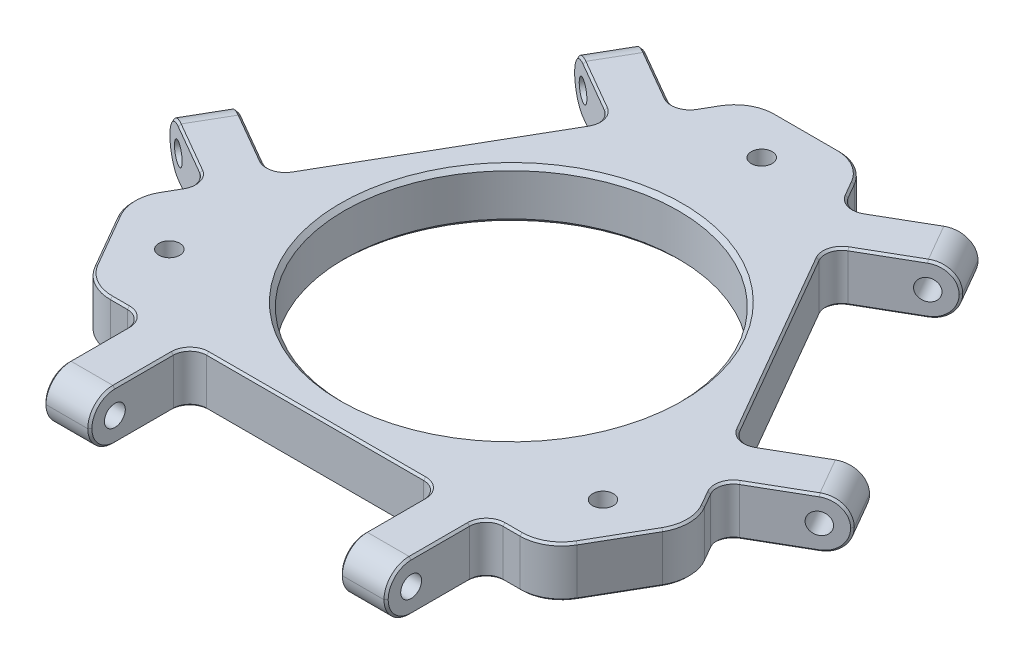
from build123d import *

# Parameters (mm, degrees)
BOSS_EXTRUDE1_DEPTH       = 6
SKETCH2_W                 = 30
SKETCH2_H                 = 12
CUT_EXTRUDE1_DEPTH        = 55.568763959
M3X0_5_TAPPED_HOLE1_D     = 2.5
M3X0_5_TAPPED_HOLE1_DEPTH = 10.697518448
CIRPATTERN1_COUNT         = 3
CIRPATTERN1_COPY_1_D      = 2.5
CIRPATTERN1_COPY_1_DEPTH  = 10.697518448
CIRPATTERN1_COPY_2_D      = 2.5
CIRPATTERN1_COPY_2_DEPTH  = 10.697518448
FILLET1_R                 = 3
M3X0_5_TAPPED_HOLE2_D     = 2.5
SKETCH14_R                = 20
CUT_EXTRUDE2_DEPTH        = 55.568763959
FILLET2_R                 = 2
FILLET3_R                 = 5
CHAMFER1_SIZE             = 0.5
CHAMFER2_SIZE             = 0.25


with BuildPart() as part:
    # Sketch1 → Boss-Extrude1 (new body)
    with BuildSketch(Plane(origin=(0, 0, 0), x_dir=(1, 0, 0), z_dir=(0, 1, 0))):
        Polygon((-20.5, 35.507041555), (-41, 0), (-20.5, -35.507041555), (20.5, -35.507041555), (41, 0), (20.5, 35.507041555), align=None)
    extrude(amount=BOSS_EXTRUDE1_DEPTH)

    # Sketch2 → Cut-Extrude1 (cut, through all)
    with BuildSketch(Plane(origin=(0, 6, 0), x_dir=(1, 0, 0), z_dir=(0, 1, 0))):
        Polygon((-20.5, -35.507041555), (-20.5, -23.507041555), (-27.42820323, -23.507041555), align=None)
        Polygon((20.5, -35.507041555), (20.5, -23.507041555), (27.42820323, -23.507041555), align=None)
        with Locations((0, -29.507041555)):
            Rectangle(SKETCH2_W, SKETCH2_H)
        Polygon((-20.5, 35.507041555), (-10.107695155, 29.507041555), (-6.643593539, 35.507041555), align=None)
        Polygon((-41, 0), (-30.607695155, -6), (-34.07179677, -12), align=None)
        Polygon((-23.25, 30.743901834), (-38.25, 4.763139721), (-27.857695155, -1.236860279), (-12.857695155, 24.743901834), align=None)
        Polygon((41, 0), (30.607695155, -6), (34.07179677, -12), align=None)
        Polygon((20.5, 35.507041555), (10.107695155, 29.507041555), (6.643593539, 35.507041555), align=None)
        Polygon((38.25, 4.763139721), (23.25, 30.743901834), (12.857695155, 24.743901834), (27.857695155, -1.236860279), align=None)
    extrude(amount=-CUT_EXTRUDE1_DEPTH, mode=Mode.SUBTRACT)

    # M3x0.5 Tapped Hole1
    with Locations(Plane.ZY.offset(20.5)):
        with Locations((32.507041555, 3)):
            m3x0_5_tapped_hole1 = Hole(M3X0_5_TAPPED_HOLE1_D / 2, depth=M3X0_5_TAPPED_HOLE1_DEPTH)

    # Mirror1: M3x0.5 Tapped Hole1 across plane
    add(m3x0_5_tapped_hole1.mirror(Plane(origin=(0, 0, 0), x_dir=(0, 0, 1), z_dir=(1, 0, 0))), mode=Mode.SUBTRACT)

    # CirPattern1: M3x0.5 Tapped Hole1 ×3 about axis
    cirpattern1_axis = Axis((0, 0, 0), (0, 1, 0))
    for i in range(1, CIRPATTERN1_COUNT):
        add(m3x0_5_tapped_hole1.rotate(cirpattern1_axis, i * 360 / CIRPATTERN1_COUNT), mode=Mode.SUBTRACT)

    # CirPattern1 copy 1
    with Locations(Plane(origin=(-10.25, 0, -17.753520778), x_dir=(0.8660254037844387, 0, -0.4999999999999998), z_dir=(-0.4999999999999998, 0, -0.8660254037844387))):
        with Locations((32.507041555, -3)):
            Hole(CIRPATTERN1_COPY_1_D / 2, depth=CIRPATTERN1_COPY_1_DEPTH)

    # CirPattern1 copy 2
    with Locations(Plane(origin=(-10.25, 0, 17.753520778), x_dir=(-0.8660254037844384, 0, -0.5000000000000004), z_dir=(-0.5000000000000004, 0, 0.8660254037844384))):
        with Locations((32.507041555, -3)):
            Hole(CIRPATTERN1_COPY_2_D / 2, depth=CIRPATTERN1_COPY_2_DEPTH)

    # Fillet1
    fillet1_edges = [part.edges().sort_by_distance(p)[0] for p in [
        (-39.625, 0, -2.38156986),
        (-21.875, 0, -33.125471695),
        (17.75, 0, 35.507041555),
        (-17.75, 0, 35.507041555),
        (21.875, 0, -33.125471695),
        (39.625, 0, -2.38156986),
        (-39.625, 6, -2.38156986),
        (17.75, 6, 35.507041555),
        (-17.75, 6, 35.507041555),
        (21.875, 6, -33.125471695),
        (39.625, 6, -2.38156986),
        (-21.875, 6, -33.125471695),
    ]]
    fillet(fillet1_edges, radius=FILLET1_R - 0.0001)  # a hair under: the kernel refuses the full size

    # M3x0.5 Tapped Hole2 (through all)
    with Locations(Plane(origin=(0, 0, 0), x_dir=(-1, 0, 0), z_dir=(0, -1, 0))):
        with Locations((25.980762114, -15), (-25.980762114, -15), (0, 30)):
            Hole(M3X0_5_TAPPED_HOLE2_D / 2)

    # Sketch14 → Cut-Extrude2 (cut, through all)
    with BuildSketch(Plane(origin=(0, 6, 0), x_dir=(1, 0, 0), z_dir=(0, 1, 0))):
        with Locations(Location((0, 0, 0), (0, 0, 270))):
            Circle(SKETCH14_R)
    extrude(amount=-CUT_EXTRUDE2_DEPTH, mode=Mode.SUBTRACT)

    # Fillet2
    fillet2_edges = [part.edges().sort_by_distance(p)[0] for p in [
        (30.607695155, 3, 6),
        (10.107695155, 3, -29.507041555),
        (-15, 3, 23.507041555),
        (15, 3, 23.507041555),
        (-30.607695155, 3, 6),
        (-20.5, 3, 23.507041555),
        (20.5, 3, 23.507041555),
        (-12.857695155, 3, -24.743901834),
        (-27.857695155, 3, 1.236860279),
        (-10.107695155, 3, -29.507041555),
        (27.857695155, 3, 1.236860279),
        (12.857695155, 3, -24.743901834),
    ]]
    fillet(fillet2_edges, radius=FILLET2_R)

    # Fillet3
    fillet3_edges = [part.edges().sort_by_distance(p)[0] for p in [
        (34.07179677, 3, 12),
        (6.643593539, 3, -35.507041555),
        (-34.07179677, 3, 12),
        (-27.42820323, 3, 23.507041555),
        (27.42820323, 3, 23.507041555),
        (-6.643593539, 3, -35.507041555),
    ]]
    fillet(fillet3_edges, radius=FILLET3_R)

    # Chamfer1
    chamfer1_edges = [part.edges().sort_by_distance(p)[0] for p in [
        (0, 0, -20),
        (0, 6, -20),
    ]]
    chamfer(chamfer1_edges, length=CHAMFER1_SIZE)

    # Chamfer2
    chamfer2_edges = [part.edges().sort_by_distance(p)[0] for p in [
        (-40.239066461, 5.121349633, 0.439325184),
        (-40.239066461, 0.878650367, 0.439325184),
        (17.620878177, 0, -27.493926834),
        (35.370878177, 0, 3.249975),
        (15, 0, 29.007091555),
        (-20.5, 0, 29.007091555),
        (-32.620878177, 0, -1.513164721),
        (-14.870878177, 0, -32.257066555),
        (-32.620878177, 6, -1.513164721),
        (-37.489066461, 5.121349633, -4.323814537),
        (-37.489066461, 0.878650367, -4.323814537),
        (-22.489066461, 5.121349633, -30.304576651),
        (-22.489066461, 0.878650367, -30.304576651),
        (-14.870878177, 6, -32.257066555),
        (-19.739066461, 5.121349633, -35.067716372),
        (-19.739066461, 0.878650367, -35.067716372),
        (20.5, 5.121349633, 34.628391188),
        (20.5, 0.878650367, 34.628391188),
        (15, 6, 29.007091555),
        (15, 5.121349633, 34.628391188),
        (15, 0.878650367, 34.628391188),
        (-15, 5.121349633, 34.628391188),
        (-15, 0.878650367, 34.628391188),
        (-20.5, 6, 29.007091555),
        (-20.5, 5.121349633, 34.628391188),
        (-20.5, 0.878650367, 34.628391188),
        (19.739066461, 5.121349633, -35.067716372),
        (19.739066461, 0.878650367, -35.067716372),
        (17.620878177, 6, -27.493926834),
        (22.489066461, 5.121349633, -30.304576651),
        (22.489066461, 0.878650367, -30.304576651),
        (37.489066461, 5.121349633, -4.323814537),
        (37.489066461, 0.878650367, -4.323814537),
        (35.370878177, 6, 3.249975),
        (40.239066461, 5.121349633, 0.439325184),
        (40.239066461, 0.878650367, 0.439325184),
        (14.870878177, 0, -32.257066555),
        (14.870878177, 6, -32.257066555),
        (32.118058126, 6, 8.616025404),
        (32.118058126, 0, 8.616025404),
        (20.357695155, 6, -11.753520778),
        (20.357695155, 0, -11.753520778),
        (32.620878177, 0, -1.513164721),
        (32.620878177, 6, -1.513164721),
        (-8.597332184, 6, -32.123066959),
        (-8.597332184, 0, -32.123066959),
        (-20.357695155, 6, -11.753520778),
        (-20.357695155, 0, -11.753520778),
        (-17.620878177, 0, -27.493926834),
        (-17.620878177, 6, -27.493926834),
        (20.5, 0, 29.007091555),
        (20.5, 6, 29.007091555),
        (-35.370878177, 0, 3.249975),
        (-35.370878177, 6, 3.249975),
        (0, 6, 23.507041555),
        (0, 0, 23.507041555),
        (-15, 0, 29.007091555),
        (-15, 6, 29.007091555),
        (-23.520725942, 6, 23.507041555),
        (-23.520725942, 0, 23.507041555),
        (10.322107872, 6, -30.30724071),
        (10.322107872, 0, -30.30724071),
        (31.40789431, 6, 6.214412717),
        (31.40789431, 0, 6.214412717),
        (13.65789431, 6, -24.529489117),
        (13.65789431, 0, -24.529489117),
        (28.072107872, 6, 0.436661124),
        (28.072107872, 0, 0.436661124),
        (-10.322107872, 6, -30.30724071),
        (-10.322107872, 0, -30.30724071),
        (-28.072107872, 6, 0.436661124),
        (-28.072107872, 0, 0.436661124),
        (-13.65789431, 6, -24.529489117),
        (-13.65789431, 0, -24.529489117),
        (21.085786438, 6, 24.092827993),
        (21.085786438, 0, 24.092827993),
        (-31.40789431, 6, 6.214412717),
        (-31.40789431, 0, 6.214412717),
        (14.414213562, 6, 24.092827993),
        (14.414213562, 0, 24.092827993),
        (-14.414213562, 6, 24.092827993),
        (-14.414213562, 0, 24.092827993),
        (-21.085786438, 6, 24.092827993),
        (-21.085786438, 0, 24.092827993),
        (30.75, 0, 17.753520778),
        (30.75, 6, 17.753520778),
        (-32.118058126, 6, 8.616025404),
        (-30.75, 6, 17.753520778),
        (23.520725942, 6, 23.507041555),
        (8.597332184, 6, -32.123066959),
        (0, 6, -35.507041555),
        (-27.041451884, 6, 22.837168574),
        (-33.298294078, 6, 12),
        (-6.256842194, 6, -34.837168574),
        (6.256842194, 6, -34.837168574),
        (27.041451884, 6, 22.837168574),
        (33.298294078, 6, 12),
        (-32.118058126, 0, 8.616025404),
        (0, 0, -35.507041555),
        (8.597332184, 0, -32.123066959),
        (23.520725942, 0, 23.507041555),
        (-30.75, 0, 17.753520778),
        (-27.041451884, 0, 22.837168574),
        (-33.298294078, 0, 12),
        (-6.256842194, 0, -34.837168574),
        (6.256842194, 0, -34.837168574),
        (27.041451884, 0, 22.837168574),
        (33.298294078, 0, 12),
    ]]
    chamfer(chamfer2_edges, length=CHAMFER2_SIZE)


solid = part.part
